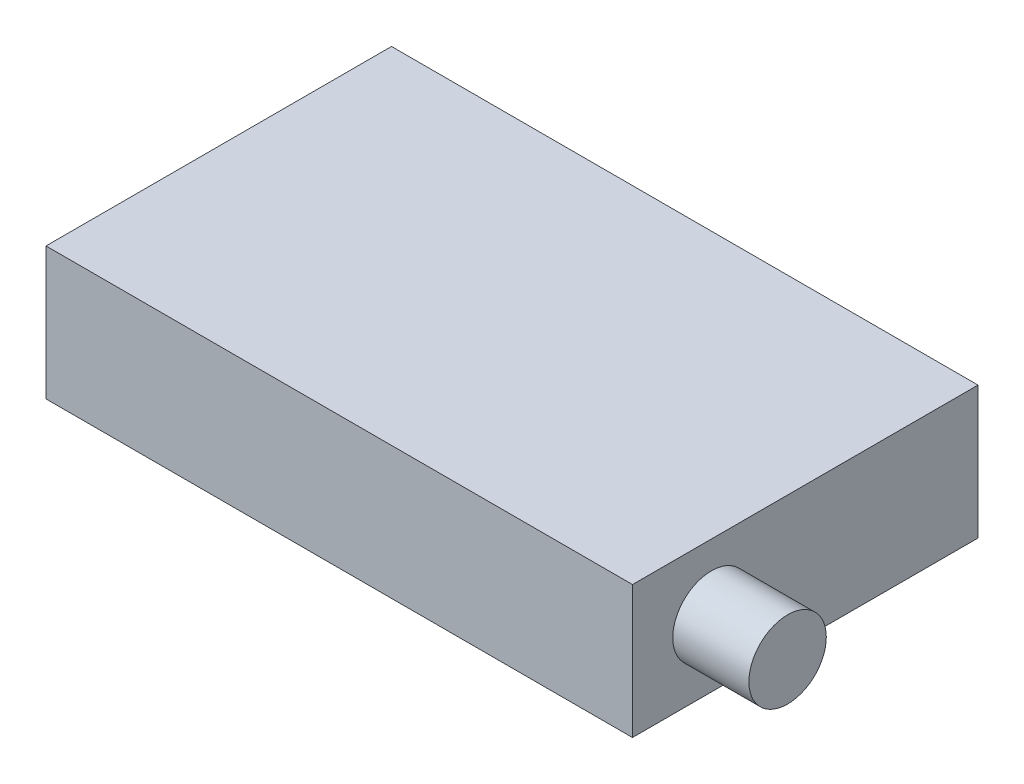
from build123d import *

# Parameters (mm, degrees)
SKETCH1_W           = 47.36
SKETCH1_H           = 27.9
BOSS_EXTRUDE1_DEPTH = 5.35
SKETCH2_R           = 3.125
BOSS_EXTRUDE2_DEPTH = 6.15
SKETCH3_W           = 11.2
SKETCH3_H           = 5
CUT_EXTRUDE1_DEPTH  = 1
SKETCH5_W           = 8.9
SKETCH5_H           = 3.2
CUT_EXTRUDE2_DEPTH  = 1


with BuildPart() as part:
    # Sketch1 → Boss-Extrude1 (new, symmetric)
    with BuildSketch(Plane(origin=(0, 0, 0), x_dir=(1, 0, 0), z_dir=(0, 1, 0))):
        Rectangle(SKETCH1_W, SKETCH1_H)
    extrude(amount=BOSS_EXTRUDE1_DEPTH, both=True)

    # Sketch2 → Boss-Extrude2 (add)
    with BuildSketch(Plane(origin=(23.68, 0, 0), x_dir=(0, 0, -1), z_dir=(1, 0, 0))):
        with Locations((-7.575, 0)):
            Circle(SKETCH2_R)
    extrude(amount=BOSS_EXTRUDE2_DEPTH)

    # Sketch3 → Cut-Extrude1 (cut)
    with BuildSketch(Plane.ZY.offset(23.68)):
        with Locations((-4.65, -1.55)):
            Rectangle(SKETCH3_W, SKETCH3_H)
    extrude(amount=-CUT_EXTRUDE1_DEPTH, mode=Mode.SUBTRACT)

    # Sketch5 → Cut-Extrude2 (cut)
    with BuildSketch(Plane.ZY.offset(23.68)):
        with Locations((5.4, -0.65)):
            Rectangle(SKETCH5_W, SKETCH5_H)
    extrude(amount=-CUT_EXTRUDE2_DEPTH, mode=Mode.SUBTRACT)


solid = part.part
